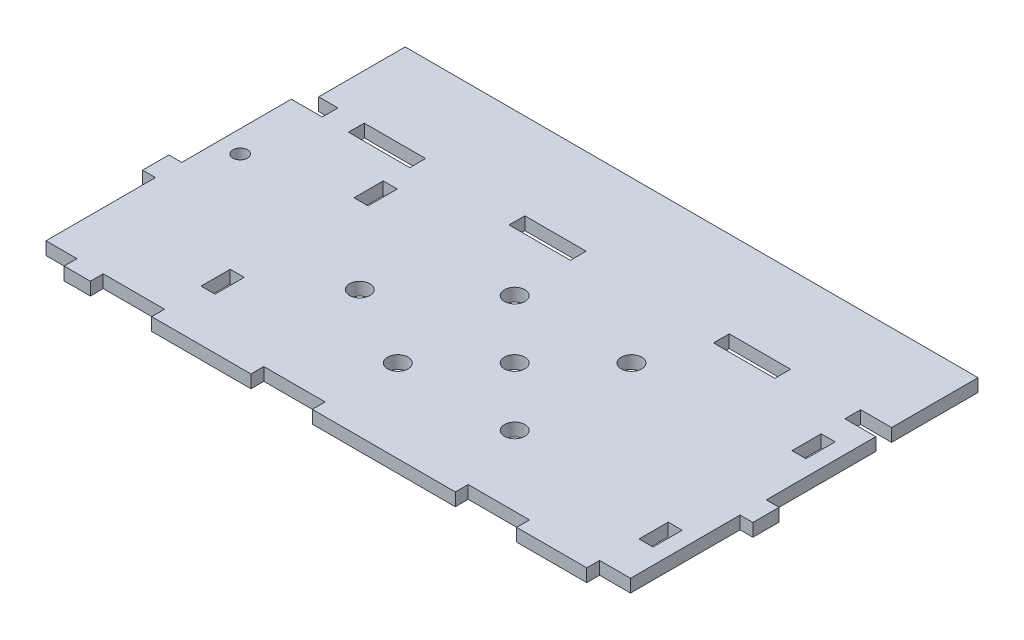
from build123d import *

# Parameters (mm, degrees)
SKETCH1_W           = 26.67
SKETCH1_H           = 6.858
BOSS_EXTRUDE1_DEPTH = 5.588
CUT_EXTRUDE1_REACH  = 184.177
SKETCH9_W           = 6.096
SKETCH9_H           = 12.7
CUT_EXTRUDE2_REACH  = 184.177
SKETCH12_R          = 3.175
CUT_EXTRUDE3_REACH  = 184.177
SKETCH13_R          = 4.445


with BuildPart() as part:
    # Sketch1 → Boss-Extrude1 (new body)
    with BuildSketch(Plane(origin=(0, 0, 0), x_dir=(1, 0, 0), z_dir=(0, 1, 0))):
        Polygon((-110.690062624, 12.380140685), (-116.278062624, 12.380140685), (-116.278062624, 0.950140685), (-110.690062624, 0.950140685), (-110.690062624, -46.674859251), (-97.228062624, -46.674859251), (-97.228062624, -52.262859251), (-85.798062624, -52.262859251), (-85.798062624, -46.674859251), (-59.128062624, -46.674859251), (-59.128062624, -52.262859251), (-15.948062624, -52.262859251), (-15.948062624, -46.674859251), (10.721937376, -46.674859251), (10.721937376, -52.262859251), (72.951937376, -52.262859251), (72.951937376, -46.674859251), (99.621937376, -46.674859251), (99.621937376, -52.262859251), (130.101937376, -52.262859251), (130.101937376, -46.67485938), (143.563937376, -46.67485938), (143.563937376, 0.950140682), (149.151937376, 0.950140682), (149.151937376, 12.38014062), (143.563937376, 12.38014062), (143.563937376, 60.00514062), (130.101937376, 60.00514062), (130.101937376, 66.86314062), (143.563937376, 66.86314062), (143.563937376, 104.45514062), (-105.610062624, 104.45514062), (-105.610062624, 66.86314062), (-97.228062624, 66.86314062), (-97.228062624, 60.00514062), (-110.690062624, 60.00514062), align=None)
        with Locations((-72.463062624, 63.43414062)):
            Rectangle(SKETCH1_W, SKETCH1_H, mode=Mode.SUBTRACT)
        with Locations((-2.613062624, 63.43414062)):
            Rectangle(SKETCH1_W, SKETCH1_H, mode=Mode.SUBTRACT)
        with Locations((86.286937376, 63.43414062)):
            Rectangle(SKETCH1_W, SKETCH1_H, mode=Mode.SUBTRACT)
    extrude(amount=BOSS_EXTRUDE1_DEPTH)

    # Sketch9 → Cut-Extrude1 (cut, up to next)
    with BuildSketch(Plane(origin=(0, 5.588, 0), x_dir=(1, 0, 0), z_dir=(0, 1, 0)), mode=Mode.PRIVATE) as cut_extrude1_sk1:
        with Locations((-56.842062624, -23.687859251)):
            Rectangle(SKETCH9_W, SKETCH9_H)
    cut_extrude1_tool1 = extrude(cut_extrude1_sk1.sketch, amount=-CUT_EXTRUDE1_REACH, mode=Mode.PRIVATE) & part.part
    # Sketch9 → Cut-Extrude1 (cut, up to next)
    with BuildSketch(Plane(origin=(0, 5.588, 0), x_dir=(1, 0, 0), z_dir=(0, 1, 0)), mode=Mode.PRIVATE) as cut_extrude1_sk2:
        with Locations((-56.842062624, 42.860140749)):
            Rectangle(SKETCH9_W, SKETCH9_H)
    cut_extrude1_tool2 = extrude(cut_extrude1_sk2.sketch, amount=-CUT_EXTRUDE1_REACH, mode=Mode.PRIVATE) & part.part
    # Sketch9 → Cut-Extrude1 (cut, up to next)
    with BuildSketch(Plane(origin=(0, 5.588, 0), x_dir=(1, 0, 0), z_dir=(0, 1, 0)), mode=Mode.PRIVATE) as cut_extrude1_sk3:
        with Locations((133.657937376, -23.687859251)):
            Rectangle(SKETCH9_W, SKETCH9_H)
    cut_extrude1_tool3 = extrude(cut_extrude1_sk3.sketch, amount=-CUT_EXTRUDE1_REACH, mode=Mode.PRIVATE) & part.part
    # Sketch9 → Cut-Extrude1 (cut, up to next)
    with BuildSketch(Plane(origin=(0, 5.588, 0), x_dir=(1, 0, 0), z_dir=(0, 1, 0)), mode=Mode.PRIVATE) as cut_extrude1_sk4:
        with Locations((133.657937376, 42.860140749)):
            Rectangle(SKETCH9_W, SKETCH9_H)
    cut_extrude1_tool4 = extrude(cut_extrude1_sk4.sketch, amount=-CUT_EXTRUDE1_REACH, mode=Mode.PRIVATE) & part.part
    add(cut_extrude1_tool1.solids().sort_by_distance((-56.842063, 5.588, 23.687859))[0], mode=Mode.SUBTRACT)
    add(cut_extrude1_tool2.solids().sort_by_distance((-56.842063, 5.588, -42.860141))[0], mode=Mode.SUBTRACT)
    add(cut_extrude1_tool3.solids().sort_by_distance((133.657937, 5.588, 23.687859))[0], mode=Mode.SUBTRACT)
    add(cut_extrude1_tool4.solids().sort_by_distance((133.657937, 5.588, -42.860141))[0], mode=Mode.SUBTRACT)

    # Sketch12 → Cut-Extrude2 (cut, up to next)
    with BuildSketch(Plane(origin=(0, 5.588, 0), x_dir=(1, 0, 0), z_dir=(0, 1, 0)), mode=Mode.PRIVATE) as cut_extrude2_sk1:
        with Locations((-101.165062624, 28.25514062)):
            Circle(SKETCH12_R)
    cut_extrude2_tool1 = extrude(cut_extrude2_sk1.sketch, amount=-CUT_EXTRUDE2_REACH, mode=Mode.PRIVATE) & part.part
    add(cut_extrude2_tool1.solids().sort_by_distance((-101.165063, 5.588, -28.255141))[0], mode=Mode.SUBTRACT)

    # Sketch13 → Cut-Extrude3 (cut, up to next)
    with BuildSketch(Plane.XZ, mode=Mode.PRIVATE) as cut_extrude3_sk1:
        with Locations((62.673131522, 16.19485938)):
            Circle(SKETCH13_R)
    cut_extrude3_tool1 = extrude(cut_extrude3_sk1.sketch, amount=-CUT_EXTRUDE3_REACH, mode=Mode.PRIVATE) & part.part
    # Sketch13 → Cut-Extrude3 (cut, up to next)
    with BuildSketch(Plane.XZ, mode=Mode.PRIVATE) as cut_extrude3_sk2:
        with Locations((11.873131522, 16.19485938)):
            Circle(SKETCH13_R)
    cut_extrude3_tool2 = extrude(cut_extrude3_sk2.sketch, amount=-CUT_EXTRUDE3_REACH, mode=Mode.PRIVATE) & part.part
    # Sketch13 → Cut-Extrude3 (cut, up to next)
    with BuildSketch(Plane.XZ, mode=Mode.PRIVATE) as cut_extrude3_sk3:
        with Locations((11.873131522, -34.60514062)):
            Circle(SKETCH13_R)
    cut_extrude3_tool3 = extrude(cut_extrude3_sk3.sketch, amount=-CUT_EXTRUDE3_REACH, mode=Mode.PRIVATE) & part.part
    # Sketch13 → Cut-Extrude3 (cut, up to next)
    with BuildSketch(Plane.XZ, mode=Mode.PRIVATE) as cut_extrude3_sk4:
        with Locations((62.673131522, -34.60514062)):
            Circle(SKETCH13_R)
    cut_extrude3_tool4 = extrude(cut_extrude3_sk4.sketch, amount=-CUT_EXTRUDE3_REACH, mode=Mode.PRIVATE) & part.part
    # Sketch13 → Cut-Extrude3 (cut, up to next)
    with BuildSketch(Plane.XZ, mode=Mode.PRIVATE) as cut_extrude3_sk5:
        with Locations((37.273131522, -9.20514062)):
            Circle(SKETCH13_R)
    cut_extrude3_tool5 = extrude(cut_extrude3_sk5.sketch, amount=-CUT_EXTRUDE3_REACH, mode=Mode.PRIVATE) & part.part
    # Sketch13 → Cut-Extrude3 (cut, up to next)
    with BuildSketch(Plane.XZ, mode=Mode.PRIVATE) as cut_extrude3_sk6:
        with Locations((-24.060880689, -3.175)):
            Circle(SKETCH13_R)
    cut_extrude3_tool6 = extrude(cut_extrude3_sk6.sketch, amount=-CUT_EXTRUDE3_REACH, mode=Mode.PRIVATE) & part.part
    add(cut_extrude3_tool1.solids().sort_by_distance((62.673132, 0, 16.194859))[0], mode=Mode.SUBTRACT)
    add(cut_extrude3_tool2.solids().sort_by_distance((11.873132, 0, 16.194859))[0], mode=Mode.SUBTRACT)
    add(cut_extrude3_tool3.solids().sort_by_distance((11.873132, 0, -34.605141))[0], mode=Mode.SUBTRACT)
    add(cut_extrude3_tool4.solids().sort_by_distance((62.673132, 0, -34.605141))[0], mode=Mode.SUBTRACT)
    add(cut_extrude3_tool5.solids().sort_by_distance((37.273132, 0, -9.205141))[0], mode=Mode.SUBTRACT)
    add(cut_extrude3_tool6.solids().sort_by_distance((-24.060881, 0, -3.175))[0], mode=Mode.SUBTRACT)


solid = part.part
